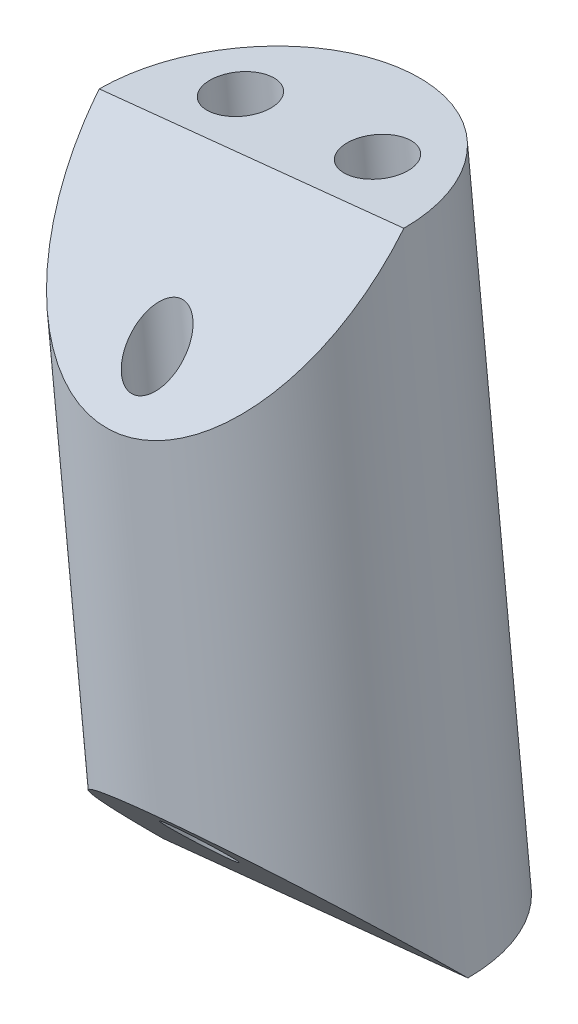
from build123d import *

# Parameters (mm, degrees)
SKETCH3_R               = 8
BOSS_EXTRUDE1_DEPTH     = 32.422105263
CUT_EXTRUDE1_DEPTH      = 200.187264303
CUT_EXTRUDE1_DEPTH_BACK = 200.187264303
CUT_EXTRUDE3_DEPTH      = 40.469057146
CUT_EXTRUDE3_DEPTH_BACK = 40.469057146
SKETCH8_R               = 1.4
SKETCH8_R_2             = 1.6


with BuildPart() as part:
    # Sketch3 → Boss-Extrude1 (new body)
    with BuildSketch(Plane(origin=(-20.344467381, 196.178792599, 0), x_dir=(-0.9946657577296572, -0.10315052302381678, 0), z_dir=(0.10315052302381678, -0.9946657577296572, 0))):
        with Locations((-10.431405186, 0)):
            Circle(SKETCH3_R)
    extrude(amount=BOSS_EXTRUDE1_DEPTH)

    # Sketch4 → Cut-Extrude1 (cut, two sides: drawn at the far end of the back side and taken through both)
    with BuildSketch(Plane(origin=(10.375761543, 1.076004901, 0), x_dir=(0.10315052302381672, -0.9946657577296572, 0), z_dir=(-0.9946657577296572, -0.10315052302381673, 0)).offset(-CUT_EXTRUDE1_DEPTH_BACK)):
        Polygon((-197.230869842, 0), (-189.230869842, 8), (-197.230869842, 8), align=None)
        Polygon((-172.808764579, 8), (-164.808764579, 8), (-164.808764579, 0), align=None)
    extrude(amount=CUT_EXTRUDE1_DEPTH + CUT_EXTRUDE1_DEPTH_BACK, mode=Mode.SUBTRACT)

    # Sketch8 → Cut-Extrude3 (cut, two sides: drawn at the far end of the back side and taken through both)
    with BuildSketch(Plane(origin=(-20.344467381, 196.178792599, 0), x_dir=(0.9946657577296572, 0.10315052302381678, 0), z_dir=(-0.10315052302381678, 0.9946657577296572, 0)).offset(-CUT_EXTRUDE3_DEPTH_BACK)):
        with Locations((10.431405186, -5.5)):
            Circle(SKETCH8_R)
        with Locations((6.831405186, 3)):
            Circle(SKETCH8_R_2)
        with Locations((14.031405186, 3)):
            Circle(SKETCH8_R_2)
    extrude(amount=CUT_EXTRUDE3_DEPTH + CUT_EXTRUDE3_DEPTH_BACK, mode=Mode.SUBTRACT)


solid = part.part
